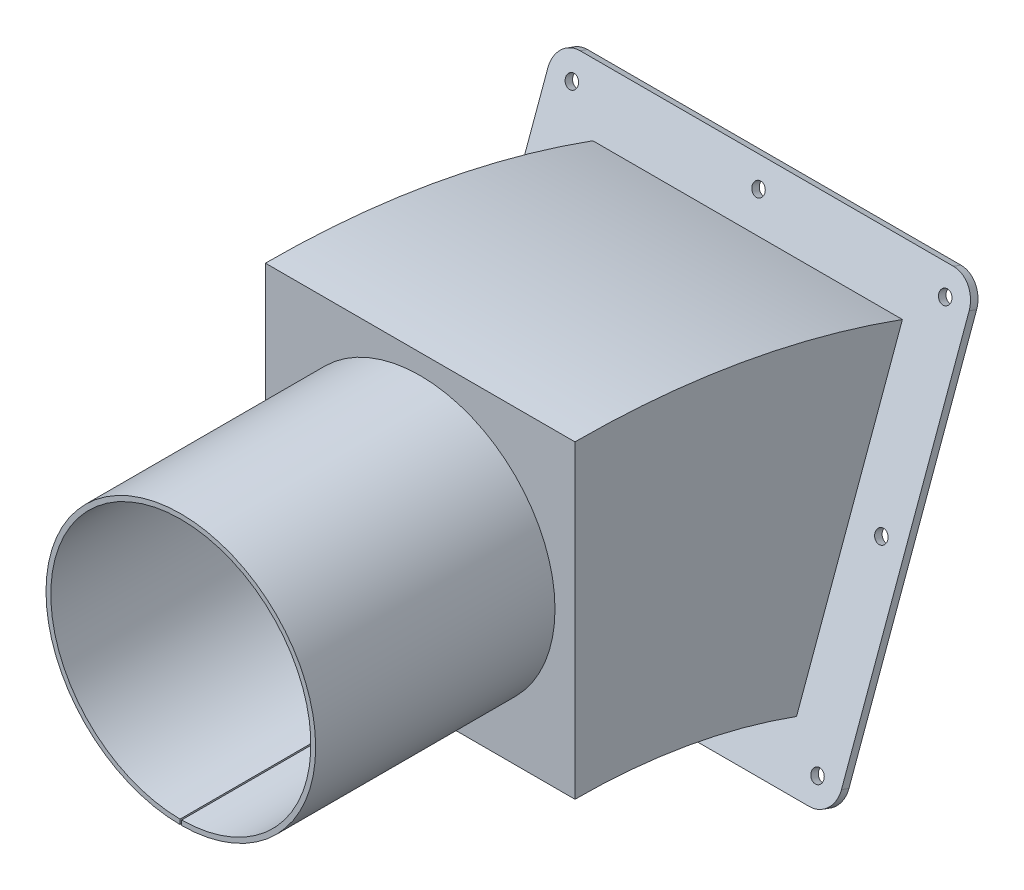
from build123d import *

# Parameters (mm, degrees)
BOSS_EXTRUDE1_DEPTH = 97
SHELL2_T            = -3
SKETCH2_R           = 80
CUT_EXTRUDE1_DEPTH  = 3
BASE_FLANGE1_DEPTH  = 150
SKETCH8_R           = 4
SKETCH8_W           = 188
SKETCH8_H           = 188
BOSS_EXTRUDE2_DEPTH = 5


# Sheet-metal steps are written as plain solids
with BuildPart() as part:
    # Sketch1 → Boss-Extrude1 (new, symmetric)
    with BuildSketch(Plane(origin=(0, 0, 0), x_dir=(0, 0, -1), z_dir=(1, 0, 0))):
        with BuildLine():
            Line((0, 600), (0, 406))
            ThreePointArc((0, 406), (70.501160133, 399.831947723), (138.86017819, 381.515204039))
            Line((138.86017819, 381.515204039), (205.212085995, 563.815572472))
            ThreePointArc((205.212085995, 563.815572472), (104.1889066, 590.884651807), (0, 600))
        make_face()
    extrude(amount=BOSS_EXTRUDE1_DEPTH, both=True)

    # Shell2
    shell2_openings = [part.faces().sort_by_distance(p)[0] for p in [
        (0, 472.665388255, -172.036132093),
    ]]
    offset(amount=SHELL2_T, openings=shell2_openings, kind=Kind.INTERSECTION)

    # Sketch2 → Cut-Extrude1 (cut)
    with BuildSketch(Plane.XY):
        with Locations((0, 503)):
            Circle(SKETCH2_R)
    extrude(amount=-CUT_EXTRUDE1_DEPTH, mode=Mode.SUBTRACT)


with BuildPart() as body_2:
    # Sketch3 → Base-Flange1 (new body)
    with BuildSketch(Plane.XY):
        with BuildLine():
            ThreePointArc((0.499997812, 418.50147929), (0, 587.5), (-0.499997812, 418.50147929))
            Line((-0.499997812, 418.50147929), (-0.48224641, 421.501426771))
            ThreePointArc((-0.48224641, 421.501426771), (0, 584.5), (0.48224641, 421.501426771))
            Line((0.48224641, 421.501426771), (0.499997812, 418.50147929))
        make_face()
    extrude(amount=BASE_FLANGE1_DEPTH)


with BuildPart() as body_3:
    # Sketch8 → Boss-Extrude2 (new body)
    with BuildSketch(Plane(origin=(0, 0, 0), x_dir=(-1, 0, 0), z_dir=(0, -0.3420201433256697, -0.939692620785908))):
        with BuildLine():
            Line((-117, 371), (117, 371))
            ThreePointArc((117, 371), (127.606601718, 375.393398282), (132, 386))
            Line((132, 386), (132, 620))
            ThreePointArc((132, 620), (127.606601718, 630.606601718), (117, 635))
            Line((117, 635), (-117, 635))
            ThreePointArc((-117, 635), (-127.606601718, 630.606601718), (-132, 620))
            Line((-132, 620), (-132, 386))
            ThreePointArc((-132, 386), (-127.606601718, 375.393398282), (-117, 371))
        make_face()
        with Locations(Location((-117, 620, 0), (0, 0, 90))):
            Circle(SKETCH8_R, mode=Mode.SUBTRACT)
        with Locations(Location((0, 620, 0), (0, 0, 90))):
            Circle(SKETCH8_R, mode=Mode.SUBTRACT)
        with Locations(Location((117, 620, 0), (0, 0, 90))):
            Circle(SKETCH8_R, mode=Mode.SUBTRACT)
        with Locations(Location((117, 503, 0), (0, 0, 90))):
            Circle(SKETCH8_R, mode=Mode.SUBTRACT)
        with Locations(Location((117, 386, 0), (0, 0, 90))):
            Circle(SKETCH8_R, mode=Mode.SUBTRACT)
        with Locations(Location((0, 386, 0), (0, 0, 90))):
            Circle(SKETCH8_R, mode=Mode.SUBTRACT)
        with Locations(Location((-117, 386, 0), (0, 0, 90))):
            Circle(SKETCH8_R, mode=Mode.SUBTRACT)
        with Locations(Location((-117, 503, 0), (0, 0, 90))):
            Circle(SKETCH8_R, mode=Mode.SUBTRACT)
        with Locations((0, 503)):
            Rectangle(SKETCH8_W, SKETCH8_H, mode=Mode.SUBTRACT)
    extrude(amount=BOSS_EXTRUDE2_DEPTH)


solid = Compound([part.part, body_2.part, body_3.part])
